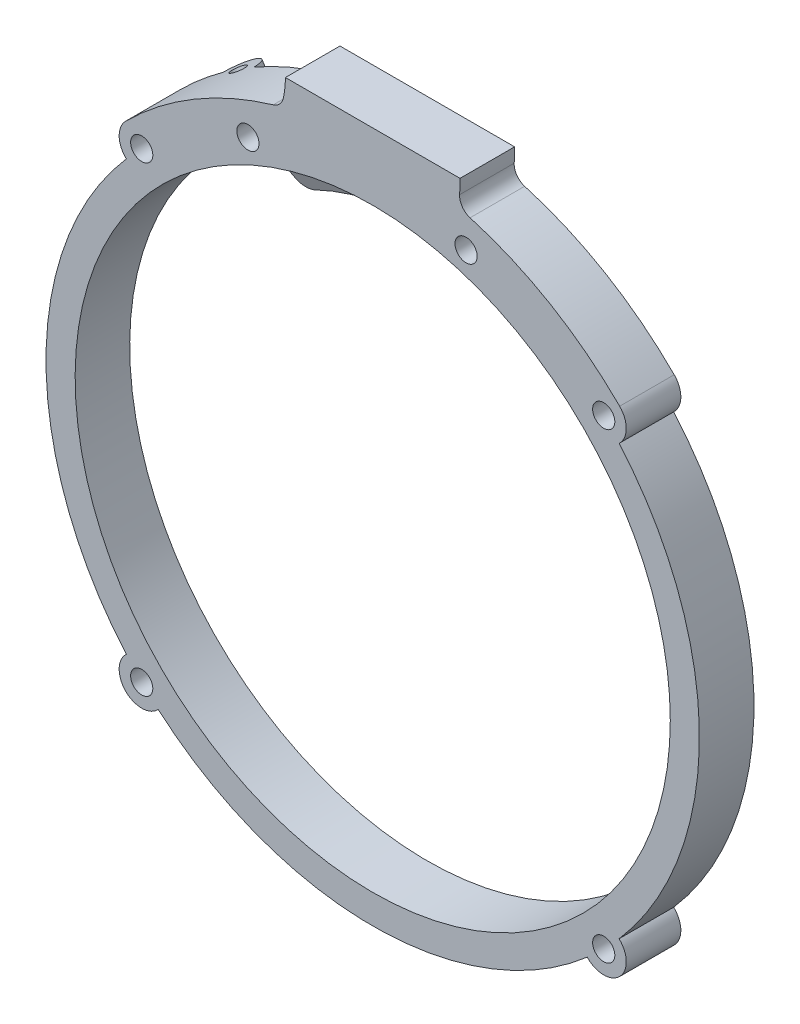
from build123d import *

# Parameters (mm, degrees)
SKETCH_1_R               = 40.9
SKETCH_1_R_2             = 1.525
EXTRUDE_1_DEPTH          = 1.5
EXTRUDE_START            = -1.5
EXTRUDE_2_DEPTH          = 1.5
SKETCH_3_R               = 1.525
CUT_EXTRUDE_1_DEPTH      = 10
SKETCH_4_R               = 1.525
SKETCH_4_R_2             = 40.9
EXTRUDE_3_DEPTH          = 6
CUT_EXTRUDE_2_DEPTH      = 70.787248119
CUT_EXTRUDE_2_DEPTH_BACK = 70.787248119
EXTRUDE_4_DEPTH          = 2.5
EXTRUDE_5_REACH          = 106.028
EXTRUDE_5_END_RADIUS     = 48
SKETCH_9_R               = 1
CUT_EXTRUDE_3_DEPTH      = 105.027800787
CHAMFER_1_SIZE           = 1.2
CHAMFER_1_SIZE_2         = 2.827022839
CHAMFER_2_SIZE           = 1.091910703
CHAMFER_2_SIZE_2         = 3


with BuildPart() as part:
    # 草图1 → 凸台-拉伸1 (new body)
    with BuildSketch(Plane.XY):
        with BuildLine():
            Line((-12, 50.1), (12, 50.1))
            ThreePointArc((12, 50.1), (11.98646104, 49.112770637), (11.945854344, 48.126283833))
            ThreePointArc((11.945854344, 48.126283833), (12.311228539, 46.859989672), (13.385132402, 46.095967617))
            ThreePointArc((13.385132402, 46.095967617), (0.147817484, -47.999772395), (-13.668785094, 46.012653847))
            ThreePointArc((-13.668785094, 46.012653847), (-12.775478285, 46.565992731), (-12.285981368, 47.495817309))
            ThreePointArc((-12.285981368, 47.495817309), (-12.071709603, 48.790080839), (-12, 50.1))
        make_face()
        Circle(SKETCH_1_R, mode=Mode.SUBTRACT)
        with Locations((-17.153096541, 40.410163067)):
            Circle(SKETCH_1_R_2, mode=Mode.SUBTRACT)
        with Locations((12.835117837, 41.981778787)):
            Circle(SKETCH_1_R_2, mode=Mode.SUBTRACT)
    extrude(amount=EXTRUDE_1_DEPTH)

    # 草图2 → 凸台-拉伸2 (add)
    with BuildSketch(Plane.XY.offset(1.5).offset(EXTRUDE_START)):
        with BuildLine():
            Line((-19.201386918, 36.112556548), (-17.121235913, 32.200361501))
            ThreePointArc((-17.121235913, 32.200361501), (-16.264760822, 31.479428059), (-15.147630365, 31.55232629))
            ThreePointArc((-15.147630365, 31.55232629), (1.579071216, 34.964360914), (17.930115588, 30.058458959))
            ThreePointArc((17.930115588, 30.058458959), (18.570370617, 29.852165239), (19.236402831, 29.946423874))
            Line((19.236402831, 29.946423874), (25.180554341, 32.229639823))
            ThreePointArc((25.180554341, 32.229639823), (3.564669878, 40.744363152), (-19.201386918, 36.112556548))
        make_face()
    extrude(amount=EXTRUDE_2_DEPTH)

    # 草图3 → 切除-拉伸1 (cut)
    with BuildSketch(Plane.XY.offset(1.5)):
        with Locations((-31.749094475, 31.749094475)):
            Circle(SKETCH_3_R)
        with Locations((31.749094475, 31.749094475)):
            Circle(SKETCH_3_R)
        with Locations((31.749094475, -31.749094475)):
            Circle(SKETCH_3_R)
        with Locations((-31.749094475, -31.749094475)):
            Circle(SKETCH_3_R)
    extrude(amount=-CUT_EXTRUDE_1_DEPTH, mode=Mode.SUBTRACT)

    # 草图4 → 凸台-拉伸3 (add)
    with BuildSketch(Plane.XY.offset(1.5)):
        with BuildLine():
            Line((12, 50.1), (-12, 50.1))
            ThreePointArc((-12, 50.1), (-12.071709603, 48.790080839), (-12.285981368, 47.495817309))
            ThreePointArc((-12.285981368, 47.495817309), (-12.775478285, 46.565992731), (-13.668785094, 46.012653847))
            ThreePointArc((-13.668785094, 46.012653847), (0.147817484, -47.999772395), (13.385132402, 46.095967617))
            ThreePointArc((13.385132402, 46.095967617), (12.311228539, 46.859989672), (11.945854344, 48.126283833))
            ThreePointArc((11.945854344, 48.126283833), (11.98646104, 49.112770637), (12, 50.1))
        make_face()
        with Locations((-31.749094475, -31.749094475)):
            Circle(SKETCH_4_R, mode=Mode.SUBTRACT)
        with Locations((31.749094475, -31.749094475)):
            Circle(SKETCH_4_R, mode=Mode.SUBTRACT)
        with Locations((31.749094475, 31.749094475)):
            Circle(SKETCH_4_R, mode=Mode.SUBTRACT)
        with Locations((12.835117837, 41.981778787)):
            Circle(SKETCH_4_R, mode=Mode.SUBTRACT)
        with Locations((-31.749094475, 31.749094475)):
            Circle(SKETCH_4_R, mode=Mode.SUBTRACT)
        with Locations((-17.153096541, 40.410163067)):
            Circle(SKETCH_4_R, mode=Mode.SUBTRACT)
        with Locations(Location((0, 0, 0), (0, 0, 118))):
            Circle(SKETCH_4_R_2, mode=Mode.SUBTRACT)
    extrude(amount=EXTRUDE_3_DEPTH)

    # 草图5 → 切除-拉伸2 (cut, two sides: drawn at the far end of the back side and taken through both)
    with BuildSketch(Plane.XY.offset(7.5).offset(-CUT_EXTRUDE_2_DEPTH_BACK)):
        with BuildLine():
            ThreePointArc((-33.864147525, 29.482698526), (-34.848632515, 31.695578705), (-33.941125497, 33.941125497))
            ThreePointArc((-33.941125497, 33.941125497), (-48, 0), (-33.941125497, -33.941125497))
            ThreePointArc((-33.941125497, -33.941125497), (-34.848632515, -31.695578705), (-33.864147525, -29.482698526))
            ThreePointArc((-33.864147525, -29.482698526), (-44.9, 0), (-33.864147525, 29.482698526))
        make_face()
        with BuildLine():
            ThreePointArc((-29.482698526, -33.864147525), (-31.695578705, -34.848632515), (-33.941125497, -33.941125497))
            ThreePointArc((-33.941125497, -33.941125497), (1.4e-08, -48), (33.941125517, -33.941125477))
            ThreePointArc((33.941125517, -33.941125477), (31.695578719, -34.848632516), (29.482698526, -33.864147525))
            ThreePointArc((29.482698526, -33.864147525), (0, -44.9), (-29.482698526, -33.864147525))
        make_face()
        with BuildLine():
            ThreePointArc((33.864147525, -29.482698526), (34.848632515, -31.695578691), (33.941125517, -33.941125477))
            ThreePointArc((33.941125517, -33.941125477), (48, 1.4e-08), (33.941125497, 33.941125497))
            ThreePointArc((33.941125497, 33.941125497), (34.848632515, 31.695578705), (33.864147525, 29.482698526))
            ThreePointArc((33.864147525, 29.482698526), (44.9, 0), (33.864147525, -29.482698526))
        make_face()
    extrude(amount=CUT_EXTRUDE_2_DEPTH + CUT_EXTRUDE_2_DEPTH_BACK, mode=Mode.SUBTRACT)

    # 草图6 → 凸台-拉伸4 (add)
    with BuildSketch(Plane(origin=(0, 0, 0), x_dir=(-1, 0, 0), z_dir=(0, 0, -1))):
        with BuildLine():
            Line((20, 35.676462829), (24.203821377, 32.969456027))
            ThreePointArc((24.203821377, 32.969456027), (22.14331564, 34.387258868), (20, 35.676462829))
        make_face()
    extrude(amount=-EXTRUDE_4_DEPTH)

    # 凸台-拉伸5: up to this cylinder (the profile starts inside it)
    extrude_5_end = Plane(origin=(0, 0, -1.061033), z_dir=(0, 0, -1)) * Cylinder(EXTRUDE_5_END_RADIUS, 309.056, mode=Mode.PRIVATE)
    # 草图8 → 凸台-拉伸5 (add, up to the surface)
    with BuildSketch(Plane(origin=(-22.101910689, 34.322959428, 0), x_dir=(0.8407642754995168, 0.5414013604007407, 0), z_dir=(0.5414013604007407, -0.8407642754995168, 0)), mode=Mode.PRIVATE) as extrude_5_sk1:
        with BuildLine():
            Line((-2.5, 0), (2.5, 0))
            ThreePointArc((2.5, 0), (0, -2.5), (-2.5, 0))
        make_face()
    extrude_5_tool1 = extrude(extrude_5_sk1.sketch, amount=-EXTRUDE_5_REACH, mode=Mode.PRIVATE) & extrude_5_end
    add(extrude_5_tool1.solids().sort_by_distance((-22.101911, 34.322959, -1.061033))[0])

    # 草图9 → 切除-拉伸3 (cut, through all)
    with BuildSketch(Plane(origin=(-22.101910689, 34.322959428, 0), x_dir=(0.8407642754995168, 0.5414013604007407, 0), z_dir=(0.5414013604007407, -0.8407642754995168, 0))):
        Circle(SKETCH_9_R)
    extrude(amount=-CUT_EXTRUDE_3_DEPTH, mode=Mode.SUBTRACT)

    # 倒角1
    # the kernel refuses this chamfer: 2.827022839, 1.2 mm, written as the material it takes off along each edge
    with BuildSketch(Plane(origin=(0, 0, 1.5), x_dir=(-0.6107495991650607, 0.79182379802562, 0), z_dir=(-0.79182379802562, -0.6107495991650607, 0))) as chamfer_1_piece_1:
        Polygon((35, CHAMFER_1_SIZE), (35 + CHAMFER_1_SIZE_2, 0), (35, 0), align=None)
    revolve(axis=Axis((0, 0, 1.5), (0, 0, -1)), revolution_arc=80.459152239, mode=Mode.SUBTRACT)

    # 倒角2
    # the kernel refuses this chamfer: 3, 1.091910703 mm, written as the material it adds along each edge
    with BuildSketch(Plane(origin=(0, 0, 1.5), x_dir=(0.7536182445133375, 0.6573123622271496, 0), z_dir=(0.6573123622271496, -0.7536182445133375, 0))) as chamfer_2_piece_1_section:
        Polygon((40.9, CHAMFER_2_SIZE), (40.9 - CHAMFER_2_SIZE_2, 0), (40.9, 0), align=None)
    chamfer_2_piece_1 = revolve(axis=Axis((0, 0, 1.5), (0, 0, 1)), revolution_arc=76.90478106, mode=Mode.PRIVATE)
    chamfer_2_piece_1 = split(chamfer_2_piece_1, bisect_by=Plane(origin=(8.613354957, 25.865990815, 2.004229424), z_dir=(-0.35856914515570787, 0.933503169861948, 0)), keep=Keep.TOP, mode=Mode.PRIVATE)
    add(chamfer_2_piece_1)


solid = part.part
